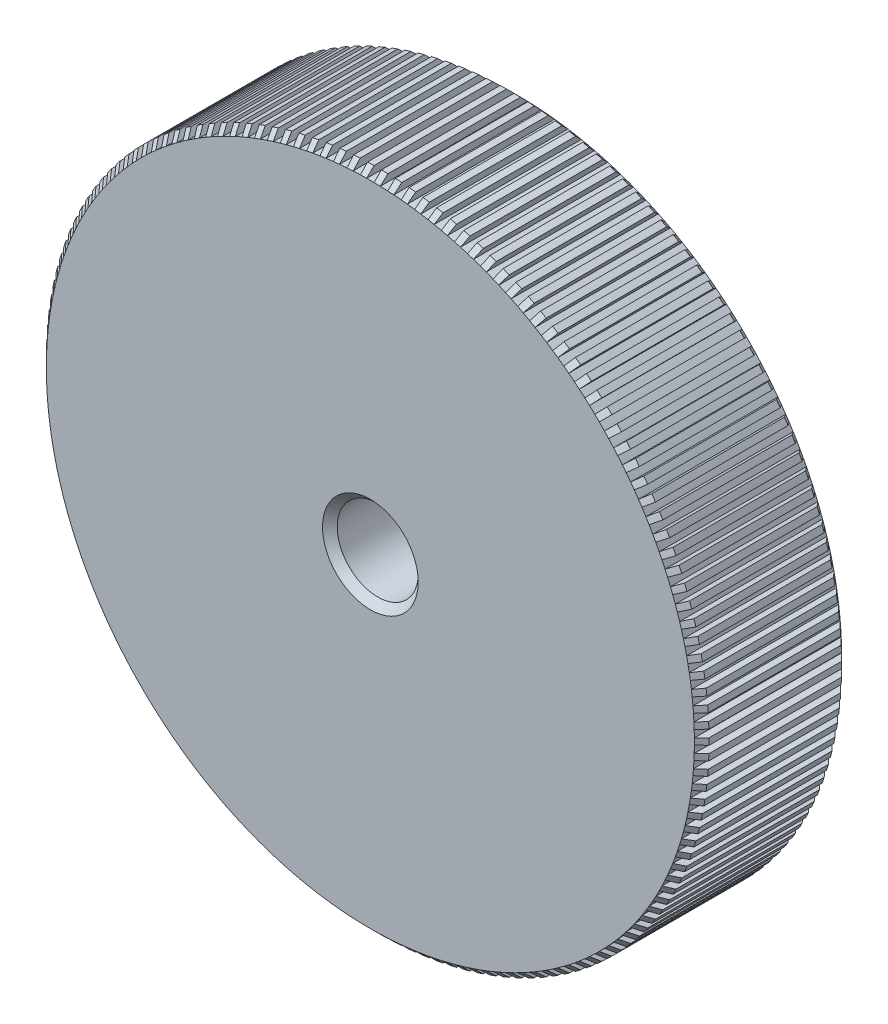
from build123d import *

# Parameters (mm, degrees)
SKETCH_1_R               = 4.5
EXTRUDE_1_DEPTH          = 2
SKETCH_8_R               = 0.55
CUT_EXTRUDE_1_DEPTH      = 7.670832032
CHAMFER_1_SIZE           = 0.1
CUT_EXTRUDE_3_DEPTH      = 7.670832032
PATTERN_CIRCULAR_1_COUNT = 150


with BuildPart() as part:
    # 草图1 → 凸台-拉伸1 (new body)
    with BuildSketch(Plane.XY):
        Circle(SKETCH_1_R)
    extrude(amount=-EXTRUDE_1_DEPTH)

    # 草图8 → 切除-拉伸1 (cut, through all)
    with BuildSketch(Plane(origin=(0, 0, -2), x_dir=(-1, 0, 0), z_dir=(0, 0, -1))):
        Circle(SKETCH_8_R)
    extrude(amount=-CUT_EXTRUDE_1_DEPTH, mode=Mode.SUBTRACT)

    # 倒角1
    chamfer_1_edges = [part.edges().sort_by_distance(p)[0] for p in [
        (0.55, 0, -2),
        (-4.5, 0, -2),
        (-4.5, 0, 0),
        (0.55, 0, 0),
    ]]
    chamfer(chamfer_1_edges, length=CHAMFER_1_SIZE)

    # 草图7 → 切除-拉伸3 (cut, through all)
    with BuildSketch(Plane.XY):
        with BuildLine():
            Line((-0.05, 4.986750572), (-0.05, 4.3997159))
            ThreePointArc((-0.05, 4.3997159), (0, 4.4), (0.05, 4.3997159))
            Line((0.05, 4.3997159), (0.05, 4.986750572))
            Line((0.05, 4.986750572), (-0.05, 4.986750572))
        make_face()
    cut_extrude_3 = extrude(amount=-CUT_EXTRUDE_3_DEPTH, mode=Mode.SUBTRACT)

    # 阵列(圆周)1: 切除-拉伸3 ×150 about axis
    pattern_circular_1_axis = Axis((0, 0, -2), (0, 0, 1))
    for i in range(1, PATTERN_CIRCULAR_1_COUNT):
        add(cut_extrude_3.rotate(pattern_circular_1_axis, i * 360 / PATTERN_CIRCULAR_1_COUNT), mode=Mode.SUBTRACT)


solid = part.part
